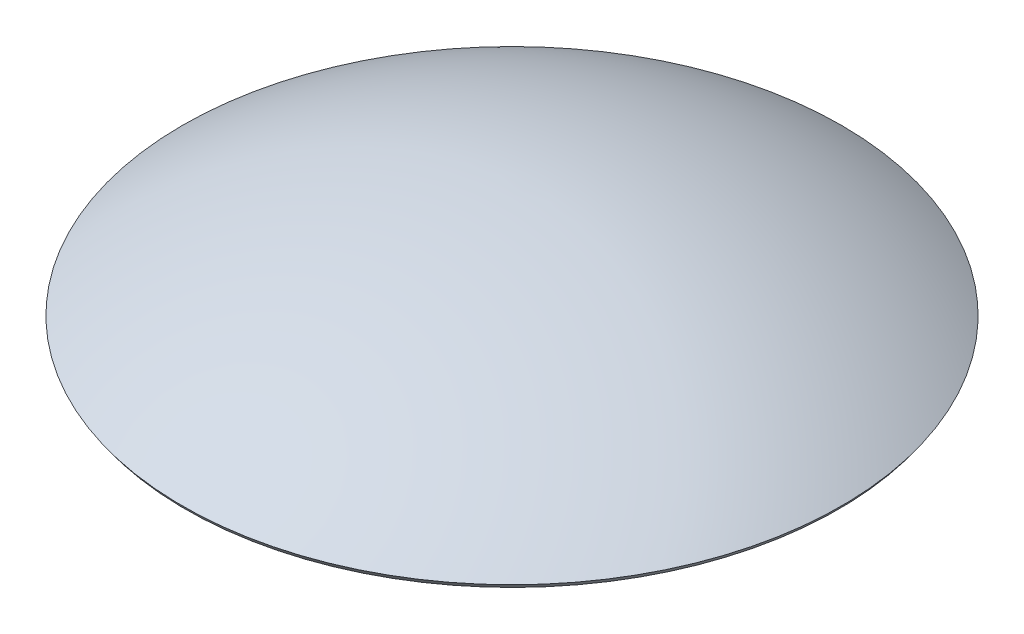
from build123d import *


with BuildPart() as part:
    # Sketch1 → Revolve1 (revolve)
    with BuildSketch(Plane.XY):
        with BuildLine():
            ThreePointArc((-122.5, 212.176223927), (-63.41066605, 236.651827441), (0, 245))
            Line((0, 245), (0, 250))
            ThreePointArc((0, 250), (-75.176449876, 238.429237687), (-143.394109088, 204.788011072))
            Line((-143.394109088, 204.788011072), (-141.960167997, 202.740130962))
            ThreePointArc((-141.960167997, 202.740130962), (-132.981653066, 208.739382839), (-123.75, 214.341287437))
            Line((-123.75, 214.341287437), (-122.5, 212.176223927))
        make_face()
    revolve(axis=Axis((0, 0, 0), (0, 1, 0)))


solid = part.part
